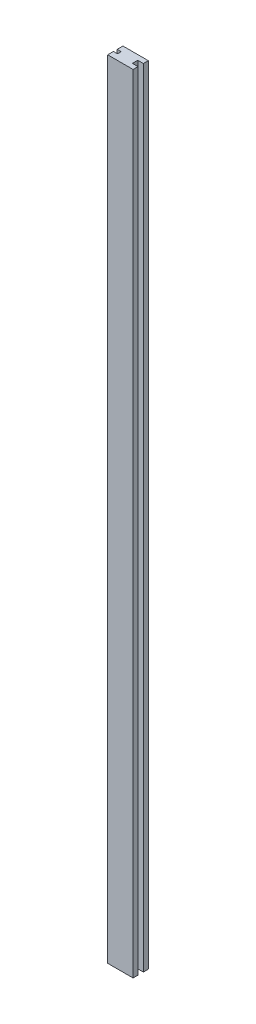
from build123d import *

# Parameters (mm, degrees)
EXTRUDE_1_DEPTH = 1550


with BuildPart() as part:
    # Эскиз1 → Бобышка-Вытянуть1 (new body)
    with BuildSketch(Plane(origin=(0, 0, 0), x_dir=(1, 0, 0), z_dir=(0, 1, 0))):
        Polygon((0, 3.657663655), (0, -3.657663655), (-7.956991175, -3.657663655), (-7.956991175, -15), (42.043008825, -15), (42.043008825, -5.25), (31, -5.25), (31, 0), (31, 5.25), (42.043008825, 5.25), (42.043008825, 15), (-7.956991175, 15), (-7.956991175, 3.657663655), align=None)
    extrude(amount=EXTRUDE_1_DEPTH)


solid = part.part
